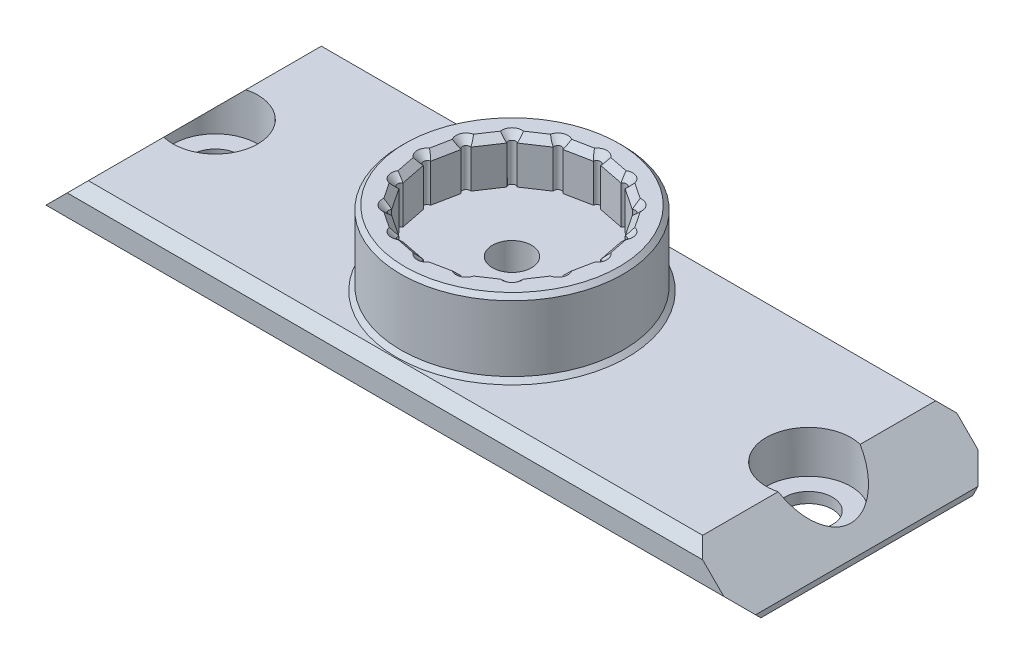
from build123d import *

# Parameters (mm, degrees)
SKETCH1_W                      = 67
SKETCH1_H                      = 24
BOSS_EXTRUDE1_DEPTH            = 5
SKETCH2_R                      = 10.5
BOSS_EXTRUDE2_DEPTH            = 7
CBORE_START                    = 1
CBORE_FOR_M4_SHCS1_OUTLINE_R   = 4
CBORE_FOR_M4_SHCS1_DEPTH       = 4
CBORE_FOR_M4_SHCS1_2_OUTLINE_R = 2.25
CBORE_FOR_M4_SHCS1_2_DEPTH     = 1
CHAMFER1_SIZE                  = 1
CHAMFER2_SIZE                  = 2
SKETCH5_OUTSIDE_W              = 83.434
SKETCH5_OUTSIDE_H              = 28.434
CUT_EXTRUDE1_DEPTH             = 43.921439864
SKETCH6_R                      = 10.5
BOSS_EXTRUDE3_DEPTH            = 7
CHAMFER4_SIZE                  = 0.4
HOLE1_D                        = 3.7
HOLE1_DEPTH                    = 16
HOLE1_TIP                      = 1.85
CUT_EXTRUDE2_DEPTH             = 4.2
SKETCH12_R                     = 0.35
CUT_EXTRUDE3_DEPTH             = 4.2
CHAMFER5_SIZE                  = 0.6


# Read off the part's stored shape, not the designer's step: CBORE for M4 SHCS1
with BuildPart() as part:
    # Sketch1 → Boss-Extrude1 (new body)
    with BuildSketch(Plane(origin=(0, 0, 0), x_dir=(1, 0, 0), z_dir=(0, 1, 0))):
        Rectangle(SKETCH1_W, SKETCH1_H)
    extrude(amount=BOSS_EXTRUDE1_DEPTH)

    # Sketch2 → Boss-Extrude2 (add)
    with BuildSketch(Plane(origin=(0, 5, 0), x_dir=(1, 0, 0), z_dir=(0, 1, 0))):
        with Locations(Location((0, 0, 0), (0, 0, 270))):
            Circle(SKETCH2_R)
    extrude(amount=BOSS_EXTRUDE2_DEPTH)

    # CBORE for M4 SHCS1 outline → CBORE for M4 SHCS1 (cut)
    with BuildSketch(Plane(origin=(0, 0, 0), x_dir=(1, 0, 0), z_dir=(0, 1, 0)).offset(CBORE_START)):
        with Locations((28, 0)):
            Circle(CBORE_FOR_M4_SHCS1_OUTLINE_R)
        with Locations((-28, 0)):
            Circle(CBORE_FOR_M4_SHCS1_OUTLINE_R)
    extrude(amount=CBORE_FOR_M4_SHCS1_DEPTH, mode=Mode.SUBTRACT)

    # CBORE for M4 SHCS1 2 outline → CBORE for M4 SHCS1 2 (cut)
    with BuildSketch(Plane(origin=(0, 0, 0), x_dir=(1, 0, 0), z_dir=(0, 1, 0))):
        with Locations((28, 0)):
            Circle(CBORE_FOR_M4_SHCS1_2_OUTLINE_R)
        with Locations((-28, 0)):
            Circle(CBORE_FOR_M4_SHCS1_2_OUTLINE_R)
    extrude(amount=CBORE_FOR_M4_SHCS1_2_DEPTH, mode=Mode.SUBTRACT)

    # Chamfer1
    chamfer1_edges = [part.edges().sort_by_distance(p)[0] for p in [
        (-33.5, 5, 0),
        (0, 5, 12),
        (33.5, 5, 0),
        (33.5, 2.5, 12),
        (-33.5, 2.5, 12),
        (-33.5, 2.5, -12),
        (33.5, 2.5, -12),
        (0, 5, -12),
    ]]
    chamfer(chamfer1_edges, length=CHAMFER1_SIZE)

    # Chamfer2
    chamfer2_edges = [part.edges().sort_by_distance(p)[0] for p in [
        (0, 0, -12),
        (0, 0, 12),
    ]]
    chamfer(chamfer2_edges, length=CHAMFER2_SIZE)

    # Sketch5 outside → Cut-Extrude1 (cut, through all)
    with BuildSketch(Plane.XY.offset(12)):
        with Locations((0, 6)):
            Rectangle(SKETCH5_OUTSIDE_W, SKETCH5_OUTSIDE_H)
        Polygon((-34, 0), (-22, 12), (22, 12), (34, 0), align=None, mode=Mode.SUBTRACT)
    extrude(amount=-CUT_EXTRUDE1_DEPTH, mode=Mode.SUBTRACT)

    # Sketch6 → Boss-Extrude3 (add)
    with BuildSketch(Plane(origin=(0, 5, 0), x_dir=(1, 0, 0), z_dir=(0, 1, 0))):
        with Locations(Location((0, 0, 0), (0, 0, 270))):
            Circle(SKETCH6_R)
    extrude(amount=BOSS_EXTRUDE3_DEPTH)

    # Chamfer4
    chamfer4_edges = [part.edges().sort_by_distance(p)[0] for p in [
        (0, 5, -10.5),
        (0, 12, -10.5),
    ]]
    chamfer(chamfer4_edges, length=CHAMFER4_SIZE)

    # Hole1
    with Locations(Plane(origin=(0, 12, 0), x_dir=(1, 0, 0), z_dir=(0, 1, 0))):
        with Locations((0, 0)):
            Hole(HOLE1_D / 2, depth=HOLE1_DEPTH)
            with Locations((0, 0, -(HOLE1_DEPTH + HOLE1_TIP / 2))):  # 90° drill point
                Cone(0, HOLE1_D / 2, HOLE1_TIP, mode=Mode.SUBTRACT)

    # Sketch11 → Cut-Extrude2 (cut)
    with BuildSketch(Plane(origin=(0, 12, 0), x_dir=(1, 0, 0), z_dir=(0, 1, 0))):
        Polygon((0, 8.1), (-3.099735802, 7.483424213), (-5.727564928, 5.727564928), (-7.483424213, 3.099735802), (-8.1, 0), (-7.483424213, -3.099735802), (-5.727564928, -5.727564928), (-3.099735802, -7.483424213), (0, -8.1), (3.099735802, -7.483424213), (5.727564928, -5.727564928), (7.483424213, -3.099735802), (8.1, 0), (7.483424213, 3.099735802), (5.727564928, 5.727564928), (3.099735802, 7.483424213), align=None)
    extrude(amount=-CUT_EXTRUDE2_DEPTH, mode=Mode.SUBTRACT)

    # Sketch12 → Cut-Extrude3 (cut)
    with BuildSketch(Plane(origin=(0, 12, 0), x_dir=(1, 0, 0), z_dir=(0, 1, 0))):
        with Locations((0, 8)):
            Circle(SKETCH12_R)
        with Locations((3.061467459, 7.39103626)):
            Circle(SKETCH12_R)
        with Locations((5.656854249, 5.656854249)):
            Circle(SKETCH12_R)
        with Locations((7.39103626, 3.061467459)):
            Circle(SKETCH12_R)
        with Locations((8, 0)):
            Circle(SKETCH12_R)
        with Locations((7.39103626, -3.061467459)):
            Circle(SKETCH12_R)
        with Locations((5.656854249, -5.656854249)):
            Circle(SKETCH12_R)
        with Locations((3.061467459, -7.39103626)):
            Circle(SKETCH12_R)
        with Locations((0, -8)):
            Circle(SKETCH12_R)
        with Locations((-3.061467459, -7.39103626)):
            Circle(SKETCH12_R)
        with Locations((-5.656854249, -5.656854249)):
            Circle(SKETCH12_R)
        with Locations((-7.39103626, -3.061467459)):
            Circle(SKETCH12_R)
        with Locations((-8, 0)):
            Circle(SKETCH12_R)
        with Locations((-7.39103626, 3.061467459)):
            Circle(SKETCH12_R)
        with Locations((-5.656854249, 5.656854249)):
            Circle(SKETCH12_R)
        with Locations((-3.061467459, 7.39103626)):
            Circle(SKETCH12_R)
    extrude(amount=-CUT_EXTRUDE3_DEPTH, mode=Mode.SUBTRACT)

    # Chamfer5
    chamfer5_edges = [part.edges().sort_by_distance(p)[0] for p in [
        (-1.549867901, 12, -7.791712107),
        (-4.413650365, 12, -6.60549457),
        (-6.60549457, 12, -4.413650365),
        (-7.791712107, 12, -1.549867901),
        (-7.791712107, 12, 1.549867901),
        (-6.60549457, 12, 4.413650365),
        (-4.413650365, 12, 6.60549457),
        (-1.549867901, 12, 7.791712107),
        (1.549867901, 12, 7.791712107),
        (4.413650365, 12, 6.60549457),
        (6.60549457, 12, 4.413650365),
        (7.791712107, 12, 1.549867901),
        (7.791712107, 12, -1.549867901),
        (6.60549457, 12, -4.413650365),
        (4.413650365, 12, -6.60549457),
        (1.549867901, 12, -7.791712107),
        (-3.19540666, 12, -7.714394096),
        (-5.904341623, 12, -5.904341623),
        (-7.714394096, 12, -3.19540666),
        (-8.35, 12, 0),
        (-7.714394096, 12, 3.19540666),
        (-5.904341623, 12, 5.904341623),
        (-3.19540666, 12, 7.714394096),
        (0, 12, 8.35),
        (3.19540666, 12, 7.714394096),
        (5.904341623, 12, 5.904341623),
        (7.714394096, 12, 3.19540666),
        (8.35, 12, 0),
        (7.714394096, 12, -3.19540666),
        (5.904341623, 12, -5.904341623),
        (3.19540666, 12, -7.714394096),
        (0, 12, -8.35),
    ]]
    chamfer(chamfer5_edges, length=CHAMFER5_SIZE)


solid = part.part
